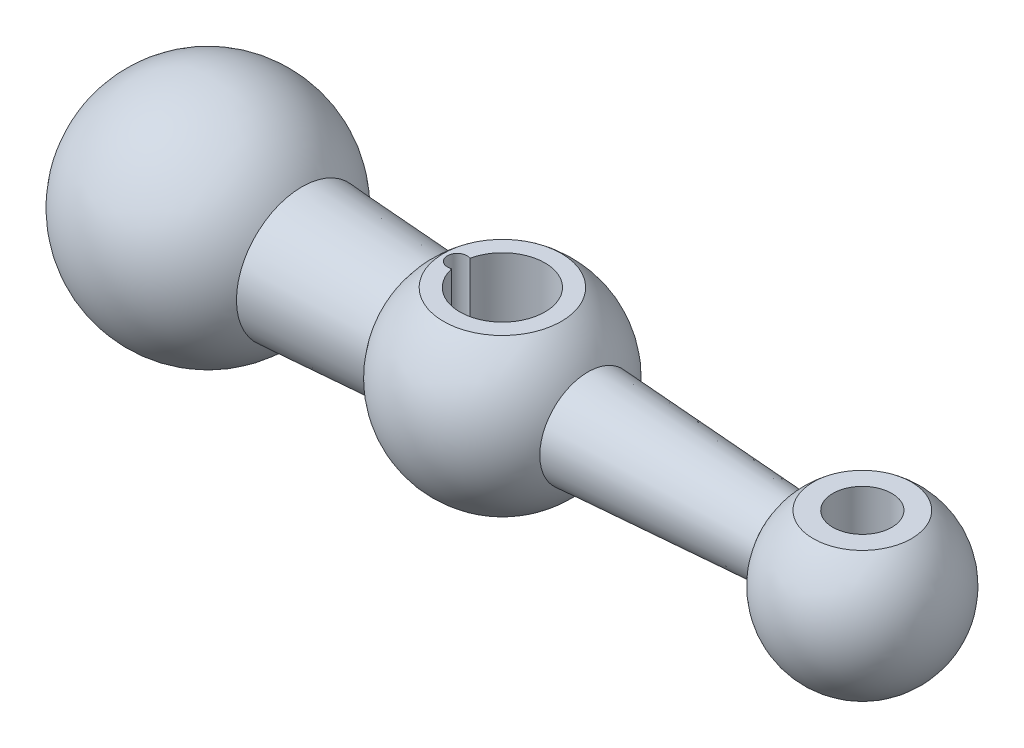
from build123d import *

# Parameters (mm, degrees)
SKETCH2_R                  = 14.892385846
CUT_EXTRUDE1_DEPTH         = 10
M10X1_0_TAPPED_HOLE1_D     = 9
M10X1_0_TAPPED_HOLE1_DEPTH = 19
CUT_EXTRUDE2_DEPTH         = 116.190060335
CUT_EXTRUDE2_DEPTH_BACK    = 116.190060335
SKETCH5_W                  = 33.852396008
SKETCH5_H                  = 3.402803332
SKETCH5_H_2                = 3.72687984
CUT_EXTRUDE3_DEPTH         = 118.612711898
CUT_EXTRUDE3_DEPTH_BACK    = 118.612711898
SKETCH6_R                  = 6.5
SKETCH7_R                  = 1.5
CUT_EXTRUDE5_DEPTH         = 12


with BuildPart() as part:
    # Sketch1 → Revolve1 (revolve)
    with BuildSketch(Plane.XY):
        with BuildLine():
            ThreePointArc((14.361406616, 10), (-5.240485866, 16.696925103), (-17.5, 0))
            Line((-17.5, 0), (112.5, 0))
            ThreePointArc((112.5, 0), (102.822928267, 12.177071733), (88.77502784, 5.5))
            Line((88.77502784, 5.5), (58.072071664, 7.356693714))
            ThreePointArc((58.072071664, 7.356693714), (45.905437929, 14.9726478), (32.909705817, 8.87833242))
            Line((32.909705817, 8.87833242), (14.361406616, 10))
        make_face()
    revolve(axis=Axis((-17.5, 0, 0), (1, 0, 0)))

    # Sketch2 → Cut-Extrude1 (cut)
    with BuildSketch(Plane(origin=(0, 10, 0), x_dir=(1, 0, 0), z_dir=(0, 1, 0))):
        with Locations((100, 0)):
            Circle(SKETCH2_R)
    extrude(amount=CUT_EXTRUDE1_DEPTH, mode=Mode.SUBTRACT)

    # M10x1.0 Tapped Hole1
    with Locations(Plane(origin=(0, 10, 0), x_dir=(1, 0, 0), z_dir=(0, 1, 0))):
        with Locations((100, 0)):
            Hole(M10X1_0_TAPPED_HOLE1_D / 2, depth=M10X1_0_TAPPED_HOLE1_DEPTH)

    # Sketch5 → Cut-Extrude2 (cut, two sides: drawn at the far end of the back side and taken through both)
    with BuildSketch(Plane.XY.offset(-CUT_EXTRUDE2_DEPTH_BACK)):
        with Locations((45.092145357, 13.701401666)):
            Rectangle(SKETCH5_W, SKETCH5_H)
        with Locations((45.092145357, -13.86343992)):
            Rectangle(SKETCH5_W, SKETCH5_H_2)
    extrude(amount=CUT_EXTRUDE2_DEPTH + CUT_EXTRUDE2_DEPTH_BACK, mode=Mode.SUBTRACT)

    # Sketch6 → Cut-Extrude3 (cut, two sides: drawn at the far end of the back side and taken through both)
    with BuildSketch(Plane(origin=(0, 12, 0), x_dir=(1, 0, 0), z_dir=(0, 1, 0)).offset(-CUT_EXTRUDE3_DEPTH_BACK)):
        with Locations((45, 0)):
            Circle(SKETCH6_R)
    extrude(amount=CUT_EXTRUDE3_DEPTH + CUT_EXTRUDE3_DEPTH_BACK, mode=Mode.SUBTRACT)

    # Sketch7 → Cut-Extrude5 (cut)
    with BuildSketch(Plane(origin=(0, 12, 0), x_dir=(1, 0, 0), z_dir=(0, 1, 0))):
        with Locations((38.103493706, 0)):
            Circle(SKETCH7_R)
    extrude(amount=-CUT_EXTRUDE5_DEPTH, mode=Mode.SUBTRACT)


solid = part.part
